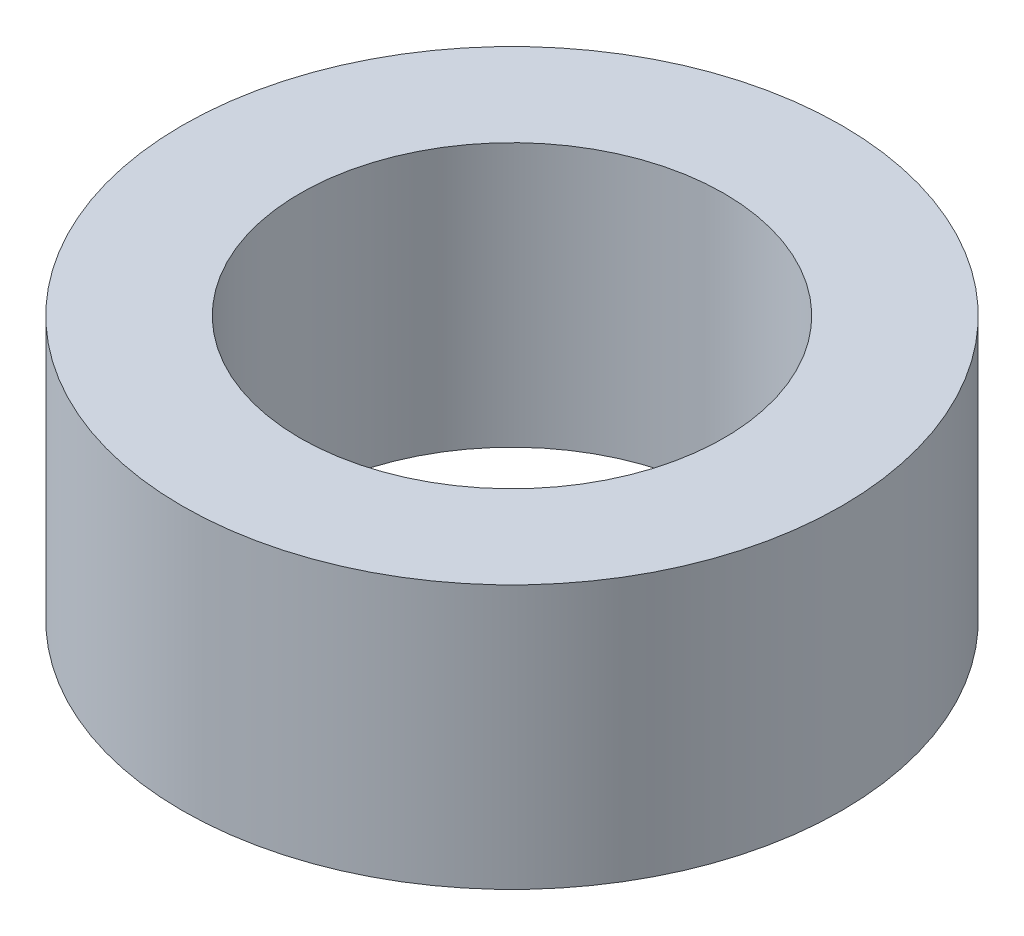
from build123d import *

# Parameters (mm, degrees)
SKETCH1_R           = 35
BOSS_EXTRUDE1_DEPTH = 28
SKETCH2_R           = 22.5
CUT_EXTRUDE1_DEPTH  = 57.868268832


with BuildPart() as part:
    # Sketch1 → Boss-Extrude1 (new body)
    with BuildSketch(Plane(origin=(0, 0, 0), x_dir=(1, 0, 0), z_dir=(0, 1, 0))):
        Circle(SKETCH1_R)
    extrude(amount=BOSS_EXTRUDE1_DEPTH)

    # Sketch2 → Cut-Extrude1 (cut, through all)
    with BuildSketch(Plane(origin=(0, 0, 0), x_dir=(1, 0, 0), z_dir=(0, 1, 0))):
        Circle(SKETCH2_R)
    extrude(amount=CUT_EXTRUDE1_DEPTH, mode=Mode.SUBTRACT)


solid = part.part
